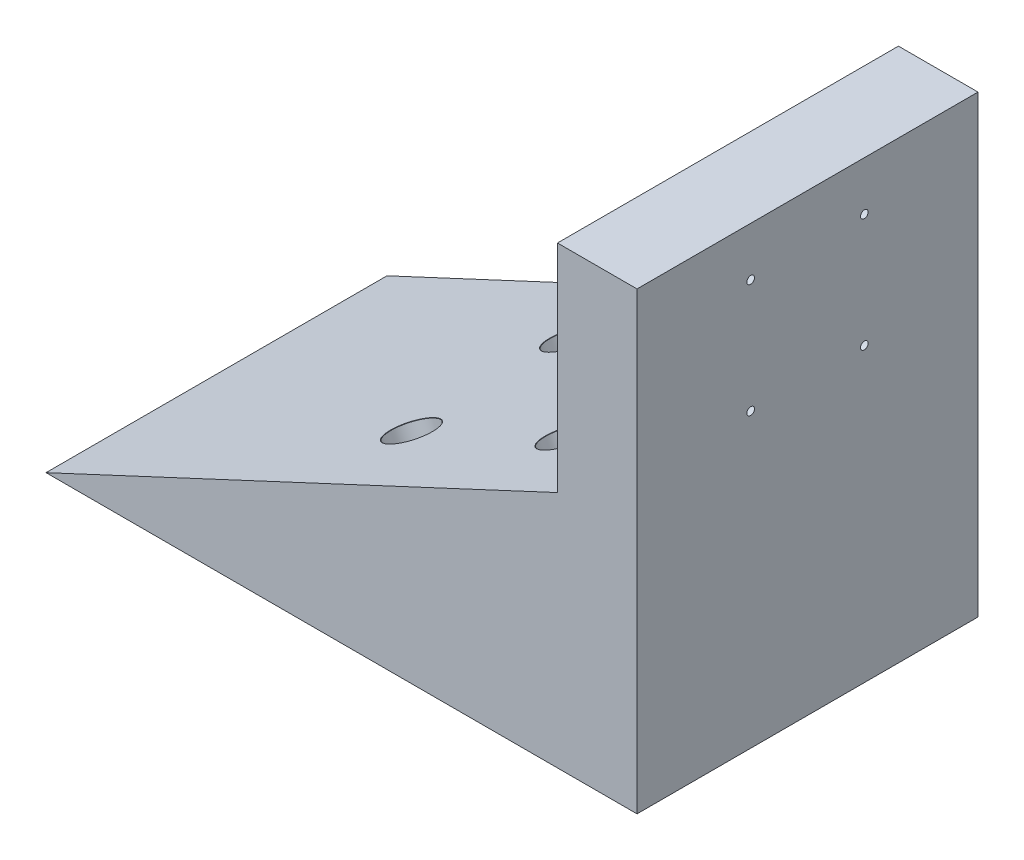
from build123d import *

# Parameters (mm, degrees)
BOSS_EXTRUDE1_DEPTH             = 15
F_4_0MM_DOWEL_HOLE1_D           = 4
F_4_0MM_DOWEL_HOLE1_DEPTH       = 6
F_4_0MM_DOWEL_HOLE1_CSINK_D     = 4.05
F_4_0MM_DOWEL_HOLE1_CSINK_ANGLE = 90
F_4_0MM_DOWEL_HOLE1_TIP         = 1.201721238
F_4_0MM_DOWEL_HOLE3_D           = 4
F_4_0MM_DOWEL_HOLE3_DEPTH       = 6
F_4_0MM_DOWEL_HOLE3_CSINK_D     = 4.05
F_4_0MM_DOWEL_HOLE3_CSINK_ANGLE = 90
F_4_0MM_DOWEL_HOLE3_TIP         = 1.201721238


# Read off the part's stored shape, not the designer's step: Ø4.0mm Dowel Hole4
with BuildPart() as part:
    # Sketch1 → Boss-Extrude1 (new, symmetric)
    with BuildSketch(Plane.XY):
        Polygon((0, 19.016155383), (0, 0), (-45, -20.983844617), (7, -20.983844617), (7, 19.016155383), align=None)
    extrude(amount=BOSS_EXTRUDE1_DEPTH, both=True)

    # Ø4.0mm Dowel Hole1
    with Locations(Plane(origin=(0, -20.983844617, 0), x_dir=(-1, 0, 0), z_dir=(0, -1, 0))):
        with Locations((0, 0), (25, 0)):
            CounterSinkHole(F_4_0MM_DOWEL_HOLE1_D / 2, F_4_0MM_DOWEL_HOLE1_CSINK_D / 2, depth=F_4_0MM_DOWEL_HOLE1_DEPTH, counter_sink_angle=F_4_0MM_DOWEL_HOLE1_CSINK_ANGLE)
            with Locations((0, 0, -(F_4_0MM_DOWEL_HOLE1_DEPTH + F_4_0MM_DOWEL_HOLE1_TIP / 2))):  # 118° drill point
                Cone(0, F_4_0MM_DOWEL_HOLE1_D / 2, F_4_0MM_DOWEL_HOLE1_TIP, mode=Mode.SUBTRACT)

    # Ø4.0mm Dowel Hole3
    with Locations(Plane(origin=(0, 0, 0), x_dir=(0.9063077870366525, 0.422618261740694, 0), z_dir=(-0.422618261740694, 0.9063077870366525, 0))):
        with Locations((-23, 7), (-8, 7), (-8, -7), (-23, -7)):
            CounterSinkHole(F_4_0MM_DOWEL_HOLE3_D / 2, F_4_0MM_DOWEL_HOLE3_CSINK_D / 2, depth=F_4_0MM_DOWEL_HOLE3_DEPTH, counter_sink_angle=F_4_0MM_DOWEL_HOLE3_CSINK_ANGLE)
            with Locations((0, 0, -(F_4_0MM_DOWEL_HOLE3_DEPTH + F_4_0MM_DOWEL_HOLE3_TIP / 2))):  # 118° drill point
                Cone(0, F_4_0MM_DOWEL_HOLE3_D / 2, F_4_0MM_DOWEL_HOLE3_TIP, mode=Mode.SUBTRACT)

    # Ø4.0mm Dowel Hole4 outline → Ø4.0mm Dowel Hole4 (revolve, cut)
    with BuildSketch(Plane(origin=(0, 4.705485654, 5), x_dir=(0, 1, 0), z_dir=(0, 0, -1))):
        Polygon((0, 0), (2.025, 0), (2, 0.025), (2, 6), (0.335720518, 7), (0, 7), align=None)
    revolve(axis=Axis((0, 4.705485654, 5), (1, 0, 0)), mode=Mode.SUBTRACT)

    # 4.0mm Dowel Hole4 2 outline → 4.0mm Dowel Hole4 2 (revolve, cut)
    with BuildSketch(Plane(origin=(0, 14.705485654, -5), x_dir=(0, 1, 0), z_dir=(0, 0, -1))):
        Polygon((0, 0), (2.025, 0), (2, 0.025), (2, 6), (0.335720518, 7), (0, 7), align=None)
    revolve(axis=Axis((0, 14.705485654, -5), (1, 0, 0)), mode=Mode.SUBTRACT)

    # 4.0mm Dowel Hole4 3 outline → 4.0mm Dowel Hole4 3 (revolve, cut)
    with BuildSketch(Plane(origin=(0, 4.705485654, -5), x_dir=(0, 1, 0), z_dir=(0, 0, -1))):
        Polygon((0, 0), (2.025, 0), (2, 0.025), (2, 6), (0.335720518, 7), (0, 7), align=None)
    revolve(axis=Axis((0, 4.705485654, -5), (1, 0, 0)), mode=Mode.SUBTRACT)

    # 4.0mm Dowel Hole4 4 outline → 4.0mm Dowel Hole4 4 (revolve, cut)
    with BuildSketch(Plane(origin=(0, 14.705485654, 5), x_dir=(0, 1, 0), z_dir=(0, 0, -1))):
        Polygon((0, 0), (2.025, 0), (2, 0.025), (2, 6), (0.335720518, 7), (0, 7), align=None)
    revolve(axis=Axis((0, 14.705485654, 5), (1, 0, 0)), mode=Mode.SUBTRACT)


solid = part.part
